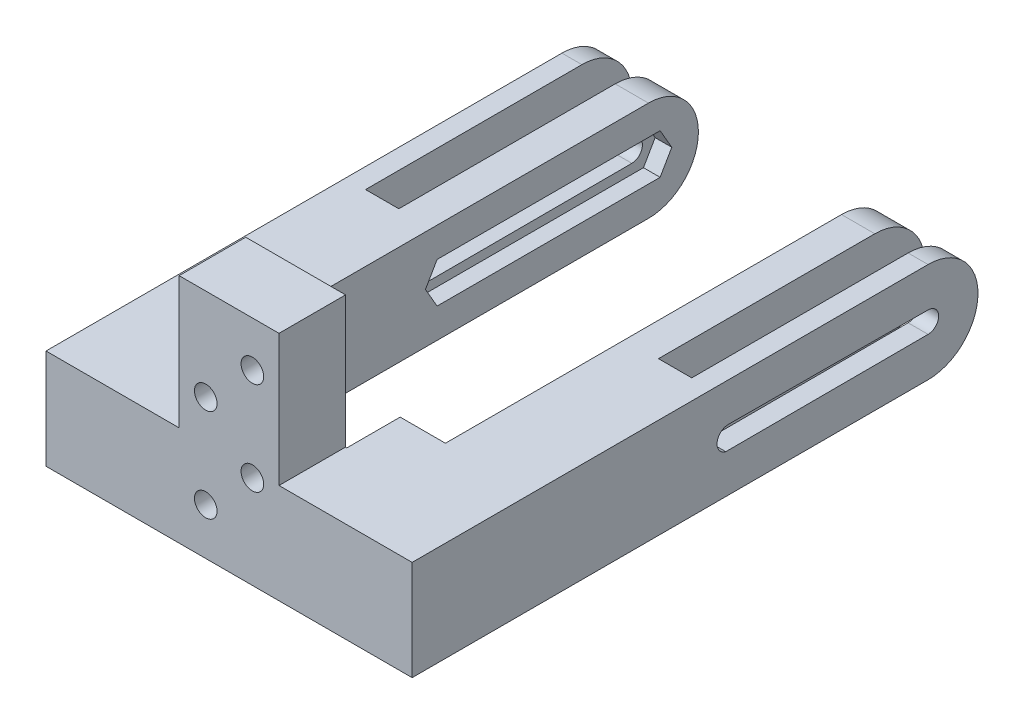
from build123d import *

# Parameters (mm, degrees)
BOSS_EXTRUDE1_DEPTH = 15
SKETCH2_W           = 15
SKETCH2_H           = 10
BOSS_EXTRUDE2_DEPTH = 19.8
SKETCH3_W           = 5
SKETCH3_H           = 15
CUT_EXTRUDE1_DEPTH  = 40
CUT_EXTRUDE2_REACH  = 89.134
SKETCH4_R           = 1.7
LPATTERN1_COUNT     = 2
LPATTERN1_PITCH     = 14
CUT_EXTRUDE3_DEPTH  = 2.5
CUT_EXTRUDE4_DEPTH  = 15
FILLET1_R           = 7.5


with BuildPart() as part:
    # Sketch1 → Boss-Extrude1 (new body)
    with BuildSketch(Plane(origin=(0, 0, 0), x_dir=(1, 0, 0), z_dir=(0, 1, 0))):
        Polygon((-27.5, 0), (27.5, 0), (27.5, 85), (14.5, 85), (14.5, 18), (7.7, 18), (7.7, 10), (-7.7, 10), (-7.7, 18), (-14.5, 18), (-14.5, 85), (-27.5, 85), align=None)
    extrude(amount=BOSS_EXTRUDE1_DEPTH)

    # Sketch2 → Boss-Extrude2 (add)
    with BuildSketch(Plane(origin=(0, 15, 0), x_dir=(1, 0, 0), z_dir=(0, 1, 0))):
        with Locations((0, 5)):
            Rectangle(SKETCH2_W, SKETCH2_H)
    extrude(amount=BOSS_EXTRUDE2_DEPTH)

    # Sketch3 → Cut-Extrude1 (cut)
    with BuildSketch(Plane(origin=(0, 0, -85), x_dir=(-1, 0, 0), z_dir=(0, 0, -1))):
        with Locations((22, 7.5)):
            Rectangle(SKETCH3_W, SKETCH3_H)
        with Locations((-22, 7.5)):
            Rectangle(SKETCH3_W, SKETCH3_H)
    extrude(amount=-CUT_EXTRUDE1_DEPTH, mode=Mode.SUBTRACT)

    # Sketch4 → Cut-Extrude2 (cut, up to next)
    with BuildSketch(Plane(origin=(0, 0, -10), x_dir=(-1, 0, 0), z_dir=(0, 0, -1)), mode=Mode.PRIVATE) as cut_extrude2_sk1:
        with Locations((-3.5, 28)):
            Circle(SKETCH4_R)
    cut_extrude2_tool1 = extrude(cut_extrude2_sk1.sketch, amount=-CUT_EXTRUDE2_REACH, mode=Mode.PRIVATE) & part.part
    # Sketch4 → Cut-Extrude2 (cut, up to next)
    with BuildSketch(Plane(origin=(0, 0, -10), x_dir=(-1, 0, 0), z_dir=(0, 0, -1)), mode=Mode.PRIVATE) as cut_extrude2_sk2:
        with Locations((3.5, 21)):
            Circle(SKETCH4_R)
    cut_extrude2_tool2 = extrude(cut_extrude2_sk2.sketch, amount=-CUT_EXTRUDE2_REACH, mode=Mode.PRIVATE) & part.part
    cut_extrude2_1 = cut_extrude2_tool1.solids().sort_by_distance((3.5, 28, -10))[0]
    add(cut_extrude2_1, mode=Mode.SUBTRACT)
    cut_extrude2_2 = cut_extrude2_tool2.solids().sort_by_distance((-3.5, 21, -10))[0]
    add(cut_extrude2_2, mode=Mode.SUBTRACT)
    cut_extrude2 = cut_extrude2_1 + cut_extrude2_2  # Cut-Extrude2 as one shape, for the pattern or mirror that repeats it

    # LPattern1: Cut-Extrude2 ×2
    with Locations(*[(0, -i * LPATTERN1_PITCH, 0) for i in range(1, LPATTERN1_COUNT)]):
        add(cut_extrude2, mode=Mode.SUBTRACT)

    # Sketch5 → Cut-Extrude3 (cut)
    with BuildSketch(Plane.ZY.offset(-14.5)):
        Polygon((-79.25, 10.531088913), (-45.75, 10.531088913), (-44, 7.5), (-45.75, 4.468911087), (-79.25, 4.468911087), (-81, 7.5), align=None)
    cut_extrude3 = extrude(amount=-CUT_EXTRUDE3_DEPTH, mode=Mode.SUBTRACT)

    # Sketch6 → Cut-Extrude4 (cut)
    with BuildSketch(Plane.ZY.offset(-17)):
        with BuildLine():
            Line((-77.5, 9.088089066), (-47.5, 9.2))
            ThreePointArc((-47.5, 9.2), (-45.811011578, 7.693178963), (-47.116144669, 5.843903661))
            Line((-47.116144669, 5.843903661), (-77.503554355, 5.911914911))
            ThreePointArc((-77.503554355, 5.911914911), (-79.088088072, 7.501777179), (-77.5, 9.088089066))
        make_face()
    cut_extrude4 = extrude(amount=-CUT_EXTRUDE4_DEPTH, mode=Mode.SUBTRACT)

    # Mirror1: Cut-Extrude3, Cut-Extrude4 across plane
    add(cut_extrude3.mirror(Plane(origin=(0, 0, 0), x_dir=(0, 0, 1), z_dir=(1, 0, 0))), mode=Mode.SUBTRACT)
    add(cut_extrude4.mirror(Plane(origin=(0, 0, 0), x_dir=(0, 0, 1), z_dir=(1, 0, 0))), mode=Mode.SUBTRACT)

    # Fillet1
    fillet1_edges = [part.edges().sort_by_distance(p)[0] for p in [
        (26, 15, -85),
        (17, 15, -85),
        (-17, 15, -85),
        (-26, 15, -85),
        (26, 0, -85),
        (17, 0, -85),
        (-17, 0, -85),
        (-26, 0, -85),
    ]]
    fillet(fillet1_edges, radius=FILLET1_R - 0.0001)  # a hair under: the kernel refuses the full size


solid = part.part
